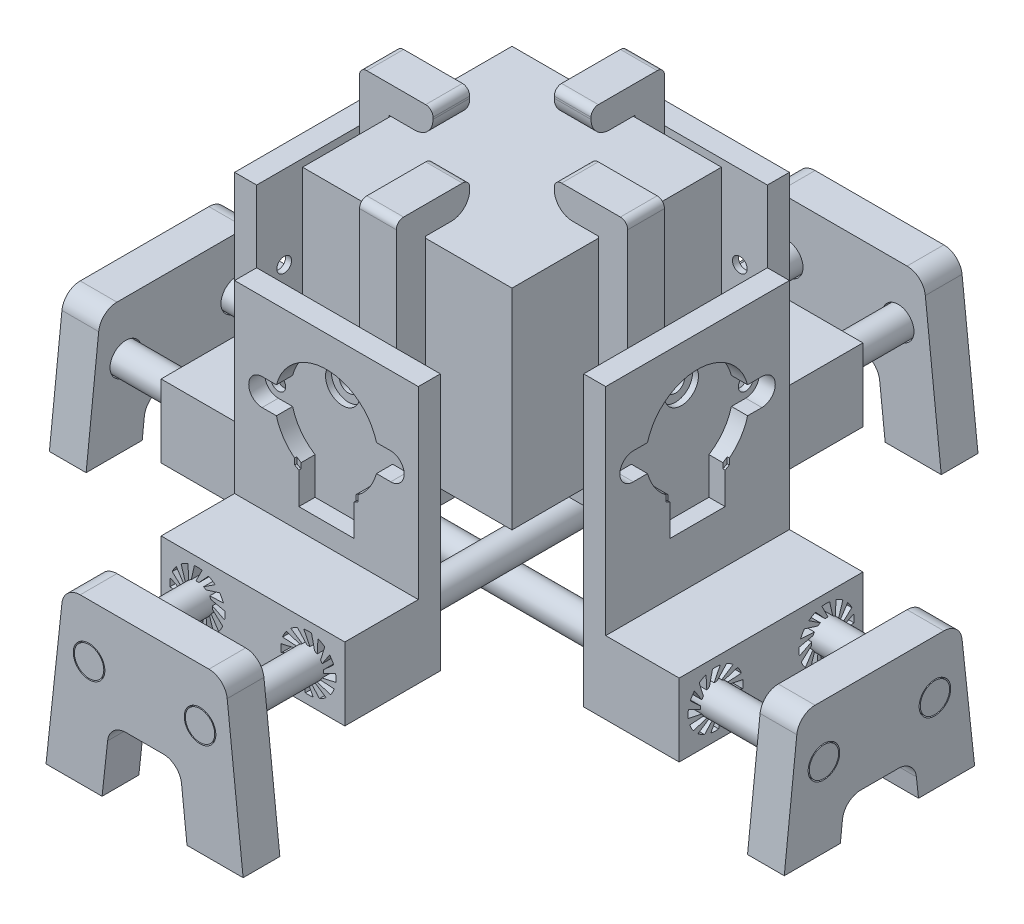
from build123d import *

# Parameters (mm, degrees)
SKETCH1_W               = 57
SKETCH1_H               = 57
BOSS_EXTRUDE1_DEPTH     = 28.5
BOSS_EXTRUDE2_DEPTH     = 5
SKETCH3_W               = 10
SKETCH3_H               = 10
BOSS_EXTRUDE3_DEPTH     = 8
SKETCH12_R              = 2.5
CUT_EXTRUDE5_DEPTH      = 2
SKETCH4_W               = 50
SKETCH4_H               = 70
SKETCH4_R               = 2
SKETCH4_R_2             = 4.65
BOSS_EXTRUDE4_DEPTH     = 1.6
SKETCH4_3_W             = 50
SKETCH4_3_H             = 70
BOSS_EXTRUDE5_DEPTH     = 6
CUT_EXTRUDE6_DEPTH      = 0.6
SKETCH9_W               = 50
SKETCH9_H               = 19.8
SKETCH9_R               = 7.5
BOSS_EXTRUDE8_DEPTH     = 20
SKETCH9_3_R             = 7.5
SKETCH9_3_R_2           = 4
CUT_EXTRUDE3_DEPTH      = 6
BOSS_EXTRUDE15_DEPTH    = 26
CIRPATTERN7_START       = 44.5
CIRPATTERN7_DEPTH       = 26
SKETCH17_W              = 1.980860953
SKETCH17_H              = 11
BOSS_EXTRUDE17_DEPTH    = 7
CUT_EXTRUDE7_DEPTH      = 7
LPATTERN1_COUNT         = 2
LPATTERN1_PITCH         = 2.5
BOSS_EXTRUDE9_START     = -50.5
SKETCH9_4_R             = 4
BOSS_EXTRUDE9_DEPTH     = 100
BOSS_EXTRUDE9_2_DEPTH   = 100
SKETCH11_R              = 4.3
BOSS_EXTRUDE13_DEPTH    = 10
FILLET1_R               = 5
BODY_MOVE_COPY5_ANGLE   = 90
BODY_MOVE_COPY5_2_ANGLE = 90
BODY_MOVE_COPY5_3_ANGLE = 90
BODY_MOVE_COPY5_4_ANGLE = 90
BODY_MOVE_COPY5_5_ANGLE = 90
SKETCH16_W              = 6
SKETCH16_H              = 50
BOSS_EXTRUDE16_DEPTH    = 8.5
SPLIT3_START            = -84.05848396
SPLIT3_OUTLINE_W        = 10
SPLIT3_OUTLINE_H        = 56
SPLIT3_DEPTH            = 8.5
CIRPATTERN8_ANGLE       = 180
CIRPATTERN8_2_ANGLE     = 180
CIRPATTERN8_3_ANGLE     = 180
CIRPATTERN8_4_ANGLE     = 180
CIRPATTERN8_5_ANGLE     = 90
CIRPATTERN8_6_ANGLE     = 180


with BuildPart() as part:
    # Sketch1 → Boss-Extrude1 (new, symmetric)
    with BuildSketch(Plane(origin=(0, 0, 0), x_dir=(1, 0, 0), z_dir=(0, 1, 0))):
        Rectangle(SKETCH1_W, SKETCH1_H)
    extrude(amount=BOSS_EXTRUDE1_DEPTH, both=True)


with BuildPart() as body_2:
    # Sketch2 → Boss-Extrude2 (new, symmetric)
    with BuildSketch(Plane(origin=(0, 0, 0), x_dir=(0, 0, -1), z_dir=(1, 0, 0))):
        with BuildLine():
            Line((-36.5, 0), (-36.5, 34.5))
            ThreePointArc((-36.5, 34.5), (-35.914213562, 35.914213562), (-34.5, 36.5))
            Line((-34.5, 36.5), (-18.5, 36.5))
            ThreePointArc((-18.5, 36.5), (-17.085786438, 35.914213562), (-16.5, 34.5))
            Line((-16.5, 34.5), (-16.5, 34))
            ThreePointArc((-16.5, 34), (-17.964466094, 30.464466094), (-21.5, 29))
            Line((-21.5, 29), (-28.5, 29))
            Line((-28.5, 29), (-28.5, 0))
            Line((-28.5, 0), (-36.5, 0))
        make_face()
    extrude(amount=BOSS_EXTRUDE2_DEPTH, both=True)


with BuildPart() as body_3:
    # Mirror2: mirrored copy
    add(body_2.part.mirror(Plane(origin=(5, 0, 36.5), x_dir=(0, 0, 1), z_dir=(0, 1, 0))))


with BuildPart() as body_2_1:
    add(body_2.part)

    # Combine1: union body 3
    add(body_3.part)

    # Sketch3 → Boss-Extrude3 (add)
    # profile 1 of 3: a face of its own
    with BuildSketch(Plane.XY.offset(36.5)):
        Rectangle(SKETCH3_W, SKETCH3_H)
        with BuildLine():
            ThreePointArc((-1.961504525, -1.55), (-2.5, 0), (-1.961504525, 1.55))
            ThreePointArc((-1.961504525, 1.55), (0, 2.5), (1.961504525, 1.55))
            ThreePointArc((1.961504525, 1.55), (2.361542008, 0.820438507), (2.5, 0))
            ThreePointArc((2.5, 0), (2.361542008, -0.820438507), (1.961504525, -1.55))
            ThreePointArc((1.961504525, -1.55), (0, -2.5), (-1.961504525, -1.55))
        make_face(mode=Mode.SUBTRACT)
    # profile 2 of 3: a face of its own
    with BuildSketch(Plane.XY.offset(36.5)):
        with BuildLine():
            ThreePointArc((1.961504525, 1.55), (0, 2.5), (-1.961504525, 1.55))
            Line((-1.961504525, 1.55), (1.961504525, 1.55))
        make_face()
    # profile 3 of 3: a face of its own
    with BuildSketch(Plane.XY.offset(36.5)):
        with BuildLine():
            Line((1.961504525, -1.55), (-1.961504525, -1.55))
            ThreePointArc((-1.961504525, -1.55), (0, -2.5), (1.961504525, -1.55))
        make_face()
    extrude(amount=BOSS_EXTRUDE3_DEPTH)

    # Sketch12 → Cut-Extrude5 (cut)
    with BuildSketch(Plane.XY.offset(44.5)):
        with Locations(Location((0, 0, 0), (0, 0, 141.683865526))):
            Circle(SKETCH12_R)
    extrude(amount=-CUT_EXTRUDE5_DEPTH, mode=Mode.SUBTRACT)


with BuildPart() as body_3_2:
    # Sketch4 → Boss-Extrude4 (new body)
    with BuildSketch(Plane.XY.offset(44.5)):
        with Locations((0, -20.45848396)):
            Rectangle(SKETCH4_W, SKETCH4_H)
        with Locations((-17.5, -8)):
            Circle(SKETCH4_R, mode=Mode.SUBTRACT)
        Circle(SKETCH4_R_2, mode=Mode.SUBTRACT)
        with Locations((17.5, -8)):
            Circle(SKETCH4_R, mode=Mode.SUBTRACT)
    extrude(amount=BOSS_EXTRUDE4_DEPTH)

    # Sketch4<3> → Boss-Extrude5 (add)
    with BuildSketch(Plane.XY.offset(44.5)):
        with Locations((0, -20.45848396)):
            Rectangle(SKETCH4_3_W, SKETCH4_3_H)
        with BuildLine():
            ThreePointArc((-7.5, -19.939849245), (-11.344049036, -16.373920914), (-13.619379575, -11.65))
            Line((-13.619379575, -11.65), (-17.5, -11.65))
            ThreePointArc((-17.5, -11.65), (-21.15, -8), (-17.5, -4.35))
            Line((-17.5, -4.35), (-13.619379575, -4.35))
            ThreePointArc((-13.619379575, -4.35), (0, 6.1), (13.619379575, -4.35))
            Line((13.619379575, -4.35), (17.5, -4.35))
            ThreePointArc((17.5, -4.35), (21.15, -8), (17.5, -11.65))
            Line((17.5, -11.65), (13.619379575, -11.65))
            ThreePointArc((13.619379575, -11.65), (11.344049036, -16.373920914), (7.5, -19.939849245))
            Line((7.5, -19.939849245), (7.5, -30))
            Line((7.5, -30), (-7.5, -30))
            Line((-7.5, -30), (-7.5, -19.939849245))
        make_face(mode=Mode.SUBTRACT)
    extrude(amount=BOSS_EXTRUDE5_DEPTH)

    # Sketch13 → Cut-Extrude6 (cut)
    with BuildSketch(Plane.XY.offset(50.5)):
        with BuildLine():
            ThreePointArc((-7.5, -19.939849245), (-8.085022182, -19.55172785), (-8.65, -19.134967445))
            Line((-8.65, -19.134967445), (-8.65, -20.771033823))
            Line((-8.65, -20.771033823), (-7.5, -21.424458688))
            Line((-7.5, -21.424458688), (-7.5, -19.939849245))
        make_face()
        with BuildLine():
            Line((7.5, -19.939849245), (7.5, -21.424458688))
            Line((7.5, -21.424458688), (8.65, -20.771033823))
            Line((8.65, -20.771033823), (8.65, -19.134967445))
            ThreePointArc((8.65, -19.134967445), (8.085022182, -19.55172785), (7.5, -19.939849245))
        make_face()
    extrude(amount=-CUT_EXTRUDE6_DEPTH, mode=Mode.SUBTRACT)

    # Sketch9 → Boss-Extrude8 (add)
    with BuildSketch(Plane.XY.offset(50.5)):
        with Locations((0, -45.55848396)):
            Rectangle(SKETCH9_W, SKETCH9_H)
        with Locations((-15.1, -45.55848396)):
            Circle(SKETCH9_R, mode=Mode.SUBTRACT)
        with Locations((15.1, -45.55848396)):
            Circle(SKETCH9_R, mode=Mode.SUBTRACT)
    extrude(amount=BOSS_EXTRUDE8_DEPTH)

    # Sketch9<3> → Cut-Extrude3 (cut)
    # profile 1 of 3: a face of its own
    with BuildSketch(Plane.XY.offset(50.5)):
        with Locations((15.1, -45.55848396)):
            Circle(SKETCH9_3_R)
        with Locations((15.1, -45.55848396)):
            Circle(SKETCH9_3_R_2, mode=Mode.SUBTRACT)
    # profile 2 of 3: a face of its own
    with BuildSketch(Plane.XY.offset(50.5)):
        with Locations((15.1, -45.55848396)):
            Circle(SKETCH9_3_R_2)
    # profile 3 of 3: a face of its own
    with BuildSketch(Plane.XY.offset(50.5)):
        with Locations((-15.1, -45.55848396)):
            Circle(SKETCH9_3_R)
    extrude(amount=-CUT_EXTRUDE3_DEPTH, mode=Mode.SUBTRACT)

    # Sketch14 → Boss-Extrude15 (add)
    with BuildSketch(Plane.XY.offset(70.5)):
        with BuildLine():
            Line((-13.830130372, -38.166770279), (-15.503691705, -41.50848396))
            Line((-15.503691705, -41.50848396), (-14.696308295, -41.50848396))
            Line((-14.696308295, -41.50848396), (-12.104862508, -38.682500292))
            ThreePointArc((-12.104862508, -38.682500292), (-12.951962339, -38.372669169), (-13.830130372, -38.166770279))
        make_face()
    boss_extrude15 = extrude(amount=-BOSS_EXTRUDE15_DEPTH)

    # CirPattern7: read off the stored shape, not the designer's step
    # CirPattern7 outline → CirPattern7 (add)
    with BuildSketch(Plane.XY.offset(CIRPATTERN7_START)):
        with BuildLine():
            Line((-10.304403804, -39.79200695), (-13.424607272, -41.849235222))
            Line((-13.424607272, -41.849235222), (-12.725392728, -42.252926927))
            Line((-12.725392728, -42.252926927), (-9.068143012, -41.101276175))
            ThreePointArc((-9.068143012, -41.101276175), (-9.646837423, -40.409404636), (-10.304403804, -39.79200695))
        make_face()
        with BuildLine():
            ThreePointArc((-15.944126678, -38.106138679), (-16.832652213, -38.261366971), (-17.696117484, -38.522137319))
            Line((-17.696117484, -38.522137319), (-17.474607272, -42.252926927))
            Line((-17.474607272, -42.252926927), (-16.775392728, -41.849235222))
            Line((-16.775392728, -41.849235222), (-15.944126678, -38.106138679))
        make_face()
        with BuildLine():
            ThreePointArc((-19.557207788, -39.526626966), (-20.249079327, -40.105321379), (-20.866477014, -40.762887761))
            Line((-20.866477014, -40.762887761), (-18.809248738, -43.883091231))
            Line((-18.809248738, -43.883091231), (-18.405557033, -43.183876688))
            Line((-18.405557033, -43.183876688), (-19.557207788, -39.526626966))
        make_face()
        with BuildLine():
            ThreePointArc((-21.975983672, -42.563346465), (-22.285814794, -43.410446297), (-22.491713684, -44.288614331))
            Line((-22.491713684, -44.288614331), (-19.15, -45.962175664))
            Line((-19.15, -45.962175664), (-19.15, -45.154792255))
            Line((-19.15, -45.154792255), (-21.975983672, -42.563346465))
        make_face()
        with BuildLine():
            ThreePointArc((-22.552345282, -46.402610637), (-22.39711699, -47.291136173), (-22.136346641, -48.154601444))
            Line((-22.136346641, -48.154601444), (-18.405557033, -47.933091231))
            Line((-18.405557033, -47.933091231), (-18.809248738, -47.233876688))
            Line((-18.809248738, -47.233876688), (-22.552345282, -46.402610637))
        make_face()
        with BuildLine():
            ThreePointArc((-21.131856992, -50.015691747), (-20.55316258, -50.707563286), (-19.895596198, -51.324960971))
            Line((-19.895596198, -51.324960971), (-16.775392728, -49.267732697))
            Line((-16.775392728, -49.267732697), (-17.474607272, -48.864040993))
            Line((-17.474607272, -48.864040993), (-21.131856992, -50.015691747))
        make_face()
        with BuildLine():
            ThreePointArc((-18.095137492, -52.434467628), (-17.248037661, -52.74429875), (-16.369869628, -52.950197639))
            Line((-16.369869628, -52.950197639), (-14.696308295, -49.60848396))
            Line((-14.696308295, -49.60848396), (-15.503691705, -49.60848396))
            Line((-15.503691705, -49.60848396), (-18.095137492, -52.434467628))
        make_face()
        with BuildLine():
            ThreePointArc((-14.255873322, -53.010829236), (-13.367347788, -52.855600944), (-12.503882518, -52.594830595))
            Line((-12.503882518, -52.594830595), (-12.725392728, -48.864040993))
            Line((-12.725392728, -48.864040993), (-13.424607272, -49.267732697))
            Line((-13.424607272, -49.267732697), (-14.255873322, -53.010829236))
        make_face()
        with BuildLine():
            ThreePointArc((-10.642792216, -51.590340947), (-9.950920678, -51.011646535), (-9.333522992, -50.354080154))
            Line((-9.333522992, -50.354080154), (-11.390751262, -47.233876688))
            Line((-11.390751262, -47.233876688), (-11.794442967, -47.933091231))
            Line((-11.794442967, -47.933091231), (-10.642792216, -51.590340947))
        make_face()
        with BuildLine():
            ThreePointArc((-8.224016336, -48.55362145), (-7.914185213, -47.70652162), (-7.708286324, -46.828353586))
            Line((-7.708286324, -46.828353586), (-11.05, -45.154792255))
            Line((-11.05, -45.154792255), (-11.05, -45.962175664))
            Line((-11.05, -45.962175664), (-8.224016336, -48.55362145))
        make_face()
        with BuildLine():
            ThreePointArc((-7.647654725, -44.714357282), (-7.802883017, -43.825831748), (-8.063653365, -42.962366477))
            Line((-8.063653365, -42.962366477), (-11.794442967, -43.183876688))
            Line((-11.794442967, -43.183876688), (-11.390751262, -43.883091231))
            Line((-11.390751262, -43.883091231), (-7.647654725, -44.714357282))
        make_face()
    cirpattern7 = extrude(amount=CIRPATTERN7_DEPTH)

    # Mirror7: Boss-Extrude15, CirPattern7 across plane
    add(boss_extrude15.mirror(Plane(origin=(0, 0, 0), x_dir=(0, 0, 1), z_dir=(1, 0, 0))))
    add(cirpattern7.mirror(Plane(origin=(0, 0, 0), x_dir=(0, 0, 1), z_dir=(1, 0, 0))))

    # Sketch17 → Boss-Extrude17 (add)
    with BuildSketch(Plane.XZ.offset(55.45848396)):
        with Locations((-9.090430476, 50)):
            Rectangle(SKETCH17_W, SKETCH17_H)
        with BuildLine():
            Line((-6.72, 55.5), (-8.1, 55.5))
            Line((-8.1, 55.5), (-8.1, 44.5))
            Line((-8.1, 44.5), (-7.469926413, 44.5))
            add(Edge.make_bspline(
                [(-6.72, 45.5), (-6.72, 45.274578408), (-6.976210068, 44.93357129), (-7.464644256, 44.816542461), (-7.469926413, 44.5)],
                knots=[0, 0, 0, 0, 0.40705548, 0.99455438, 0.99455438, 0.99455438, 0.99455438], degree=3))
            add(Edge.make_bspline(
                [(-6.72, 45.5), (-6.72, 45.725421592), (-6.976210068, 46.06642871), (-7.464644256, 46.183457539), (-7.469926413, 46.5)],
                knots=[0, 0, 0, 0, 0.40705548, 0.99455438, 0.99455438, 0.99455438, 0.99455438], degree=3))
            add(Edge.make_bspline(
                [(-6.72, 47.5), (-6.72, 47.274578408), (-6.976210068, 46.93357129), (-7.464644256, 46.816542461), (-7.469926413, 46.5)],
                knots=[0, 0, 0, 0, 0.40705548, 0.99455438, 0.99455438, 0.99455438, 0.99455438], degree=3))
            add(Edge.make_bspline(
                [(-6.72, 47.5), (-6.72, 47.725421592), (-6.976210068, 48.06642871), (-7.464644256, 48.183457539), (-7.469926413, 48.5)],
                knots=[0, 0, 0, 0, 0.40705548, 0.99455438, 0.99455438, 0.99455438, 0.99455438], degree=3))
            add(Edge.make_bspline(
                [(-6.72, 49.5), (-6.72, 49.274578408), (-6.976210068, 48.93357129), (-7.464644256, 48.816542461), (-7.469926413, 48.5)],
                knots=[0, 0, 0, 0, 0.40705548, 0.99455438, 0.99455438, 0.99455438, 0.99455438], degree=3))
            add(Edge.make_bspline(
                [(-6.72, 49.5), (-6.72, 49.725421592), (-6.976210068, 50.06642871), (-7.464644256, 50.183457539), (-7.469926413, 50.5)],
                knots=[0, 0, 0, 0, 0.40705548, 0.99455438, 0.99455438, 0.99455438, 0.99455438], degree=3))
            add(Edge.make_bspline(
                [(-6.72, 51.5), (-6.72, 51.274578408), (-6.976210068, 50.93357129), (-7.464644256, 50.816542461), (-7.469926413, 50.5)],
                knots=[0, 0, 0, 0, 0.40705548, 0.99455438, 0.99455438, 0.99455438, 0.99455438], degree=3))
            add(Edge.make_bspline(
                [(-6.72, 51.5), (-6.72, 51.725421592), (-6.976210068, 52.06642871), (-7.464644256, 52.183457539), (-7.469926413, 52.5)],
                knots=[0, 0, 0, 0, 0.40705548, 0.99455438, 0.99455438, 0.99455438, 0.99455438], degree=3))
            add(Edge.make_bspline(
                [(-6.72, 53.5), (-6.72, 53.274578408), (-6.976210068, 52.93357129), (-7.464644256, 52.816542461), (-7.469926413, 52.5)],
                knots=[0, 0, 0, 0, 0.40705548, 0.99455438, 0.99455438, 0.99455438, 0.99455438], degree=3))
            add(Edge.make_bspline(
                [(-6.72, 53.5), (-6.72, 53.725421592), (-6.976210068, 54.06642871), (-7.464644256, 54.183457539), (-7.469926413, 54.5)],
                knots=[0, 0, 0, 0, 0.40705548, 0.99455438, 0.99455438, 0.99455438, 0.99455438], degree=3))
            add(Edge.make_bspline(
                [(-6.72, 55.5), (-6.72, 55.274578408), (-6.976210068, 54.93357129), (-7.464644256, 54.816542461), (-7.469926413, 54.5)],
                knots=[0, 0, 0, 0, 0.40705548, 0.99455438, 0.99455438, 0.99455438, 0.99455438], degree=3))
        make_face()
        with BuildLine():
            Line((-2.119139047, 55.5), (-6.72, 55.5))
            add(Edge.make_bspline(
                [(-6.72, 55.5), (-6.72, 55.274578408), (-6.976210068, 54.93357129), (-7.464644256, 54.816542461), (-7.469926413, 54.5)],
                knots=[0, 0, 0, 0, 0.40705548, 0.99455438, 0.99455438, 0.99455438, 0.99455438], degree=3))
            add(Edge.make_bspline(
                [(-6.72, 53.5), (-6.72, 53.725421592), (-6.976210068, 54.06642871), (-7.464644256, 54.183457539), (-7.469926413, 54.5)],
                knots=[0, 0, 0, 0, 0.40705548, 0.99455438, 0.99455438, 0.99455438, 0.99455438], degree=3))
            add(Edge.make_bspline(
                [(-6.72, 53.5), (-6.72, 53.274578408), (-6.976210068, 52.93357129), (-7.464644256, 52.816542461), (-7.469926413, 52.5)],
                knots=[0, 0, 0, 0, 0.40705548, 0.99455438, 0.99455438, 0.99455438, 0.99455438], degree=3))
            add(Edge.make_bspline(
                [(-6.72, 51.5), (-6.72, 51.725421592), (-6.976210068, 52.06642871), (-7.464644256, 52.183457539), (-7.469926413, 52.5)],
                knots=[0, 0, 0, 0, 0.40705548, 0.99455438, 0.99455438, 0.99455438, 0.99455438], degree=3))
            add(Edge.make_bspline(
                [(-6.72, 51.5), (-6.72, 51.274578408), (-6.976210068, 50.93357129), (-7.464644256, 50.816542461), (-7.469926413, 50.5)],
                knots=[0, 0, 0, 0, 0.40705548, 0.99455438, 0.99455438, 0.99455438, 0.99455438], degree=3))
            add(Edge.make_bspline(
                [(-6.72, 49.5), (-6.72, 49.725421592), (-6.976210068, 50.06642871), (-7.464644256, 50.183457539), (-7.469926413, 50.5)],
                knots=[0, 0, 0, 0, 0.40705548, 0.99455438, 0.99455438, 0.99455438, 0.99455438], degree=3))
            add(Edge.make_bspline(
                [(-6.72, 49.5), (-6.72, 49.274578408), (-6.976210068, 48.93357129), (-7.464644256, 48.816542461), (-7.469926413, 48.5)],
                knots=[0, 0, 0, 0, 0.40705548, 0.99455438, 0.99455438, 0.99455438, 0.99455438], degree=3))
            add(Edge.make_bspline(
                [(-6.72, 47.5), (-6.72, 47.725421592), (-6.976210068, 48.06642871), (-7.464644256, 48.183457539), (-7.469926413, 48.5)],
                knots=[0, 0, 0, 0, 0.40705548, 0.99455438, 0.99455438, 0.99455438, 0.99455438], degree=3))
            add(Edge.make_bspline(
                [(-6.72, 47.5), (-6.72, 47.274578408), (-6.976210068, 46.93357129), (-7.464644256, 46.816542461), (-7.469926413, 46.5)],
                knots=[0, 0, 0, 0, 0.40705548, 0.99455438, 0.99455438, 0.99455438, 0.99455438], degree=3))
            add(Edge.make_bspline(
                [(-6.72, 45.5), (-6.72, 45.725421592), (-6.976210068, 46.06642871), (-7.464644256, 46.183457539), (-7.469926413, 46.5)],
                knots=[0, 0, 0, 0, 0.40705548, 0.99455438, 0.99455438, 0.99455438, 0.99455438], degree=3))
            add(Edge.make_bspline(
                [(-6.72, 45.5), (-6.72, 45.274578408), (-6.976210068, 44.93357129), (-7.464644256, 44.816542461), (-7.469926413, 44.5)],
                knots=[0, 0, 0, 0, 0.40705548, 0.99455438, 0.99455438, 0.99455438, 0.99455438], degree=3))
            Line((-7.469926413, 44.5), (-6.72, 44.5))
            Line((-6.72, 44.5), (-2.119139047, 44.5))
            Line((-2.119139047, 44.5), (-2.119139047, 55.5))
        make_face()
    extrude(amount=BOSS_EXTRUDE17_DEPTH)

    # Sketch17<3> → Cut-Extrude7 (cut)
    with BuildSketch(Plane.XZ.offset(55.45848396)):
        with BuildLine():
            Line((-6.72, 55.5), (-8.1, 55.5))
            Line((-8.1, 55.5), (-8.1, 44.5))
            Line((-8.1, 44.5), (-7.469926413, 44.5))
            add(Edge.make_bspline(
                [(-6.72, 45.5), (-6.72, 45.274578408), (-6.976210068, 44.93357129), (-7.464644256, 44.816542461), (-7.469926413, 44.5)],
                knots=[0, 0, 0, 0, 0.40705548, 0.99455438, 0.99455438, 0.99455438, 0.99455438], degree=3))
            add(Edge.make_bspline(
                [(-6.72, 45.5), (-6.72, 45.725421592), (-6.976210068, 46.06642871), (-7.464644256, 46.183457539), (-7.469926413, 46.5)],
                knots=[0, 0, 0, 0, 0.40705548, 0.99455438, 0.99455438, 0.99455438, 0.99455438], degree=3))
            add(Edge.make_bspline(
                [(-6.72, 47.5), (-6.72, 47.274578408), (-6.976210068, 46.93357129), (-7.464644256, 46.816542461), (-7.469926413, 46.5)],
                knots=[0, 0, 0, 0, 0.40705548, 0.99455438, 0.99455438, 0.99455438, 0.99455438], degree=3))
            add(Edge.make_bspline(
                [(-6.72, 47.5), (-6.72, 47.725421592), (-6.976210068, 48.06642871), (-7.464644256, 48.183457539), (-7.469926413, 48.5)],
                knots=[0, 0, 0, 0, 0.40705548, 0.99455438, 0.99455438, 0.99455438, 0.99455438], degree=3))
            add(Edge.make_bspline(
                [(-6.72, 49.5), (-6.72, 49.274578408), (-6.976210068, 48.93357129), (-7.464644256, 48.816542461), (-7.469926413, 48.5)],
                knots=[0, 0, 0, 0, 0.40705548, 0.99455438, 0.99455438, 0.99455438, 0.99455438], degree=3))
            add(Edge.make_bspline(
                [(-6.72, 49.5), (-6.72, 49.725421592), (-6.976210068, 50.06642871), (-7.464644256, 50.183457539), (-7.469926413, 50.5)],
                knots=[0, 0, 0, 0, 0.40705548, 0.99455438, 0.99455438, 0.99455438, 0.99455438], degree=3))
            add(Edge.make_bspline(
                [(-6.72, 51.5), (-6.72, 51.274578408), (-6.976210068, 50.93357129), (-7.464644256, 50.816542461), (-7.469926413, 50.5)],
                knots=[0, 0, 0, 0, 0.40705548, 0.99455438, 0.99455438, 0.99455438, 0.99455438], degree=3))
            add(Edge.make_bspline(
                [(-6.72, 51.5), (-6.72, 51.725421592), (-6.976210068, 52.06642871), (-7.464644256, 52.183457539), (-7.469926413, 52.5)],
                knots=[0, 0, 0, 0, 0.40705548, 0.99455438, 0.99455438, 0.99455438, 0.99455438], degree=3))
            add(Edge.make_bspline(
                [(-6.72, 53.5), (-6.72, 53.274578408), (-6.976210068, 52.93357129), (-7.464644256, 52.816542461), (-7.469926413, 52.5)],
                knots=[0, 0, 0, 0, 0.40705548, 0.99455438, 0.99455438, 0.99455438, 0.99455438], degree=3))
            add(Edge.make_bspline(
                [(-6.72, 53.5), (-6.72, 53.725421592), (-6.976210068, 54.06642871), (-7.464644256, 54.183457539), (-7.469926413, 54.5)],
                knots=[0, 0, 0, 0, 0.40705548, 0.99455438, 0.99455438, 0.99455438, 0.99455438], degree=3))
            add(Edge.make_bspline(
                [(-6.72, 55.5), (-6.72, 55.274578408), (-6.976210068, 54.93357129), (-7.464644256, 54.816542461), (-7.469926413, 54.5)],
                knots=[0, 0, 0, 0, 0.40705548, 0.99455438, 0.99455438, 0.99455438, 0.99455438], degree=3))
        make_face()
    cut_extrude7 = extrude(amount=CUT_EXTRUDE7_DEPTH, mode=Mode.SUBTRACT)

    # LPattern1: Cut-Extrude7 ×2
    with Locations(*[(i * LPATTERN1_PITCH, 0, 0) for i in range(1, LPATTERN1_COUNT)]):
        add(cut_extrude7, mode=Mode.SUBTRACT)


with BuildPart() as body_4:
    # Sketch9<4> → Boss-Extrude9 (new, symmetric)
    with BuildSketch(Plane.XY.offset(50.5).offset(BOSS_EXTRUDE9_START)):
        with Locations((-15.1, -45.55848396)):
            Circle(SKETCH9_4_R)
    extrude(amount=BOSS_EXTRUDE9_DEPTH, both=True)


with BuildPart() as body_5:
    # Sketch9<4> → Boss-Extrude9 2 (new, symmetric)
    with BuildSketch(Plane.XY.offset(50.5).offset(BOSS_EXTRUDE9_START)):
        with Locations((15.1, -45.55848396)):
            Circle(SKETCH9_4_R)
    extrude(amount=BOSS_EXTRUDE9_2_DEPTH, both=True)


with BuildPart() as body_6:
    # Sketch11 → Boss-Extrude13 (new body)
    with BuildSketch(Plane.XY.offset(100)):
        Polygon((-22.003481602, -31.044631363), (22.003481602, -31.044631363), (26.82274247, -75.55848396), (11.557165131, -75.55848396), (9.577160596, -57.269864098), (-9.577160596, -57.269864098), (-11.557165131, -75.55848396), (-26.82274247, -75.55848396), align=None)
        with Locations(Location((-15.1, -45.55848396, 0), (0, 0, 180))):
            Circle(SKETCH11_R, mode=Mode.SUBTRACT)
        with Locations((15.1, -45.55848396)):
            Circle(SKETCH11_R, mode=Mode.SUBTRACT)
    extrude(amount=-BOSS_EXTRUDE13_DEPTH)

    # Fillet1
    fillet1_edges = [body_6.edges().sort_by_distance(p)[0] for p in [
        (9.577160596, -57.269864098, 95),
        (-9.577160596, -57.269864098, 95),
        (-22.003481602, -31.044631363, 95),
        (22.003481602, -31.044631363, 95),
    ]]
    fillet(fillet1_edges, radius=FILLET1_R)


with BuildPart() as body_7:
    # Body-Move/Copy5: read off the stored shape, not the designer's step
    # Body-Move/Copy5: copy of body 2
    add(body_2_1.part.rotate(Axis((0, 0, 0), (0, 1, 0)), BODY_MOVE_COPY5_ANGLE))


with BuildPart() as body_8:
    # Body-Move_Copy5 2: copy of body 6
    add(body_6.part.rotate(Axis((0, 0, 0), (0, 1, 0)), BODY_MOVE_COPY5_2_ANGLE))


with BuildPart() as body_9:
    # Body-Move_Copy5 3: copy of body 5
    add(body_5.part.rotate(Axis((0, 0, 0), (0, 1, 0)), BODY_MOVE_COPY5_3_ANGLE))


with BuildPart() as body_10:
    # Body-Move_Copy5 4: copy of body 5
    add(body_5.part.moved(Location((-30.2, 0, 0))).rotate(Axis((0, 0, 0), (0, 1, 0)), BODY_MOVE_COPY5_4_ANGLE))


with BuildPart() as body_11:
    # Body-Move_Copy5 5: copy of body 3 2
    add(body_3_2.part.rotate(Axis((0, 0, 0), (0, 1, 0)), BODY_MOVE_COPY5_5_ANGLE))


with BuildPart() as body_12:
    # Split2: read off the stored shape, not the designer's step
    # Split2: the piece on the far side of the plane
    add(body_11.part)
    split(bisect_by=Plane(origin=(0, -35.65848396, 0), x_dir=(1, 0, 0), z_dir=(0, 1, 0)), keep=Keep.BOTTOM)


with BuildPart() as body_11_1:
    add(body_11.part)

    # Split2
    split(bisect_by=Plane(origin=(0, -35.65848396, 0), x_dir=(1, 0, 0), z_dir=(0, 1, 0)), keep=Keep.TOP)



with BuildPart() as body_12_1:
    # Body-Move/Copy6: moved
    add(body_12.part.moved(Location((0, -8.5, 0))))


with BuildPart() as body_10_1:
    # Body-Move/Copy6: moved
    add(body_10.part.moved(Location((0, -8.5, 0))))


with BuildPart() as body_9_1:
    # Body-Move/Copy6: moved
    add(body_9.part.moved(Location((0, -8.5, 0))))


with BuildPart() as body_8_1:
    # Body-Move/Copy6: moved
    add(body_8.part.moved(Location((0, -8.5, 0))))

    # Split3: read off the stored shape, not the designer's step
    # Split3 outline → Split3 (cut)
    with BuildSketch(Plane(origin=(0, 0, 0), x_dir=(1, 0, 0), z_dir=(0, 1, 0)).offset(SPLIT3_START)):
        with Locations((95, 0)):
            Rectangle(SPLIT3_OUTLINE_W, SPLIT3_OUTLINE_H)
    extrude(amount=SPLIT3_DEPTH, mode=Mode.SUBTRACT)


with BuildPart() as body_11_2:
    add(body_11_1.part)

    add(body_12_1.part)  # Boss-Extrude16 merges body 12
    # Sketch16 → Boss-Extrude16 (add)
    with BuildSketch(Plane.XZ.offset(35.65848396)):
        with Locations((47.5, 0)):
            Rectangle(SKETCH16_W, SKETCH16_H)
    extrude(amount=BOSS_EXTRUDE16_DEPTH)


with BuildPart() as body_12_2:
    # CirPattern8: read off the stored shape, not the designer's step
    # CirPattern8: copy of body 6
    add(body_6.part.rotate(Axis((0, 0, 0), (0, 1, 0)), CIRPATTERN8_ANGLE))


with BuildPart() as body_13:
    # CirPattern8 2: copy of body 3 2
    add(body_3_2.part.rotate(Axis((0, 0, 0), (0, 1, 0)), CIRPATTERN8_2_ANGLE))


with BuildPart() as body_14:
    # CirPattern8 3: copy of body 11
    add(body_11_2.part.rotate(Axis((0, 0, 0), (0, 1, 0)), CIRPATTERN8_3_ANGLE))


with BuildPart() as body_15:
    # CirPattern8 4: copy of body 8
    add(body_8_1.part.rotate(Axis((0, 0, 0), (0, 1, 0)), CIRPATTERN8_4_ANGLE))


with BuildPart() as body_16:
    # CirPattern8 5: copy of body 7
    add(body_7.part.rotate(Axis((0, 0, 0), (0, 1, 0)), CIRPATTERN8_5_ANGLE))


with BuildPart() as body_17:
    # CirPattern8 6: copy of body 7
    add(body_7.part.rotate(Axis((0, 0, 0), (0, 1, 0)), CIRPATTERN8_6_ANGLE))


solid = Compound([part.part, body_2_1.part, body_3_2.part, body_4.part, body_5.part, body_6.part, body_7.part, body_10_1.part, body_9_1.part, body_8_1.part, body_11_2.part, body_12_2.part, body_13.part, body_14.part, body_15.part, body_16.part, body_17.part])
